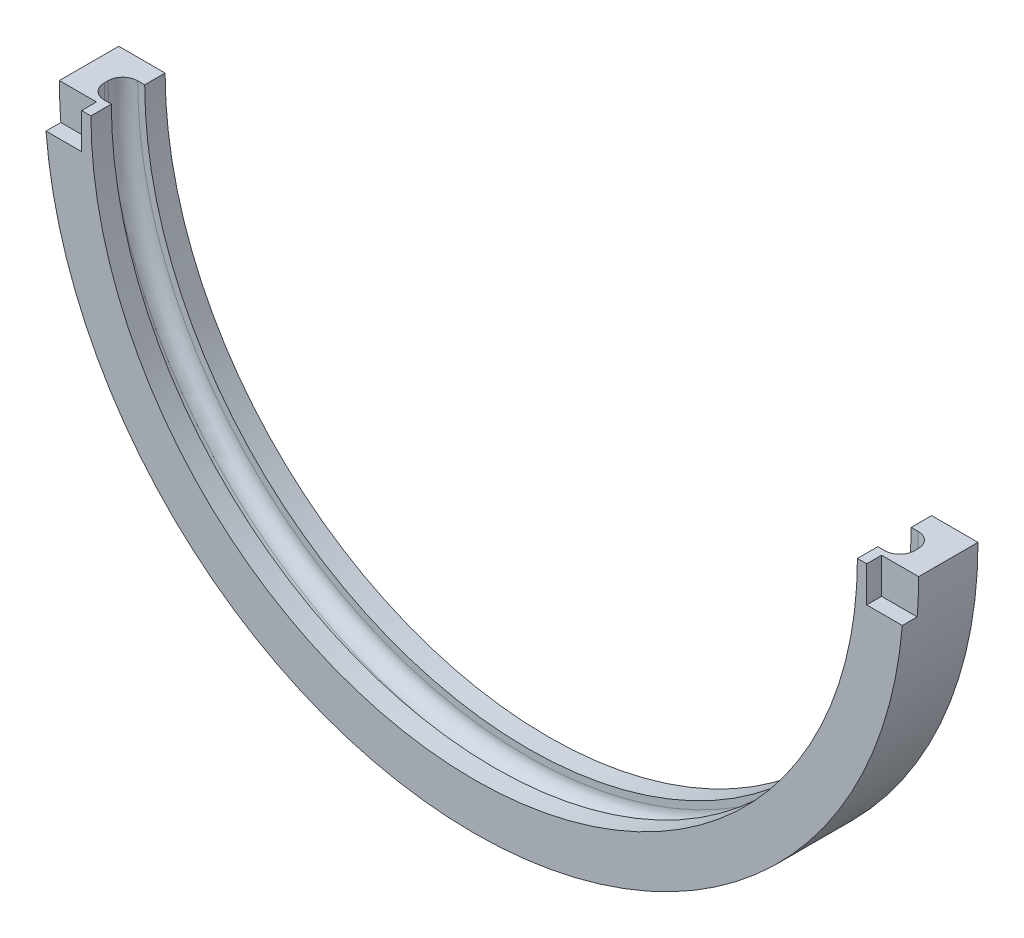
from build123d import *

# Parameters (mm, degrees)
BOSS_EXTRUDE1_DEPTH = 5.715
BOSS_EXTRUDE2_DEPTH = 3.4925
BOSS_EXTRUDE3_START = 3.4925
BOSS_EXTRUDE3_DEPTH = 3.4925
FILLET1_R           = 2.54
SKETCH6_W           = 6.645493415
SKETCH6_H           = 6.096
CUT_EXTRUDE5_DEPTH  = 2.54


with BuildPart() as part:
    # Sketch1 → Boss-Extrude1 (new body)
    with BuildSketch(Plane.XY):
        with BuildLine():
            ThreePointArc((69.342, 73.533), (0, 4.191), (-69.342, 73.533))
            Line((-69.342, 73.533), (-73.533, 73.533))
            ThreePointArc((-73.533, 73.533), (0, 0), (73.533, 73.533))
            Line((73.533, 73.533), (69.342, 73.533))
        make_face()
    extrude(amount=BOSS_EXTRUDE1_DEPTH)

    # Sketch3 → Boss-Extrude2 (add)
    with BuildSketch(Plane.XY.offset(5.715)):
        with BuildLine():
            ThreePointArc((65.5955, 73.533), (0, 7.9375), (-65.5955, 73.533))
            Line((-65.5955, 73.533), (-73.533, 73.533))
            ThreePointArc((-73.533, 73.533), (0, 0), (73.533, 73.533))
            Line((73.533, 73.533), (65.5955, 73.533))
        make_face()
    extrude(amount=BOSS_EXTRUDE2_DEPTH)

    # Sketch4 → Boss-Extrude3 (add)
    with BuildSketch(Plane(origin=(0, 0, 0), x_dir=(-1, 0, 0), z_dir=(0, 0, -1)).offset(BOSS_EXTRUDE3_START)):
        with BuildLine():
            ThreePointArc((65.5955, 73.533), (0, 7.9375), (-65.5955, 73.533))
            Line((-65.5955, 73.533), (-73.533, 73.533))
            ThreePointArc((-73.533, 73.533), (0, 0), (73.533, 73.533))
            Line((73.533, 73.533), (65.5955, 73.533))
        make_face()
    extrude(amount=-BOSS_EXTRUDE3_DEPTH)

    # Fillet1
    fillet1_edges = [part.edges().sort_by_distance(p)[0] for p in [
        (0, 4.191, 5.715),
        (0, 4.191, 0),
    ]]
    fillet(fillet1_edges, radius=FILLET1_R)

    # Sketch6 → Cut-Extrude5 (cut)
    with BuildSketch(Plane.XY.offset(9.2075)):
        with Locations((-70.506627119, 70.485)):
            Rectangle(SKETCH6_W, SKETCH6_H)
        with Locations((70.506627119, 70.485)):
            Rectangle(SKETCH6_W, SKETCH6_H)
    extrude(amount=-CUT_EXTRUDE5_DEPTH, mode=Mode.SUBTRACT)


solid = part.part
